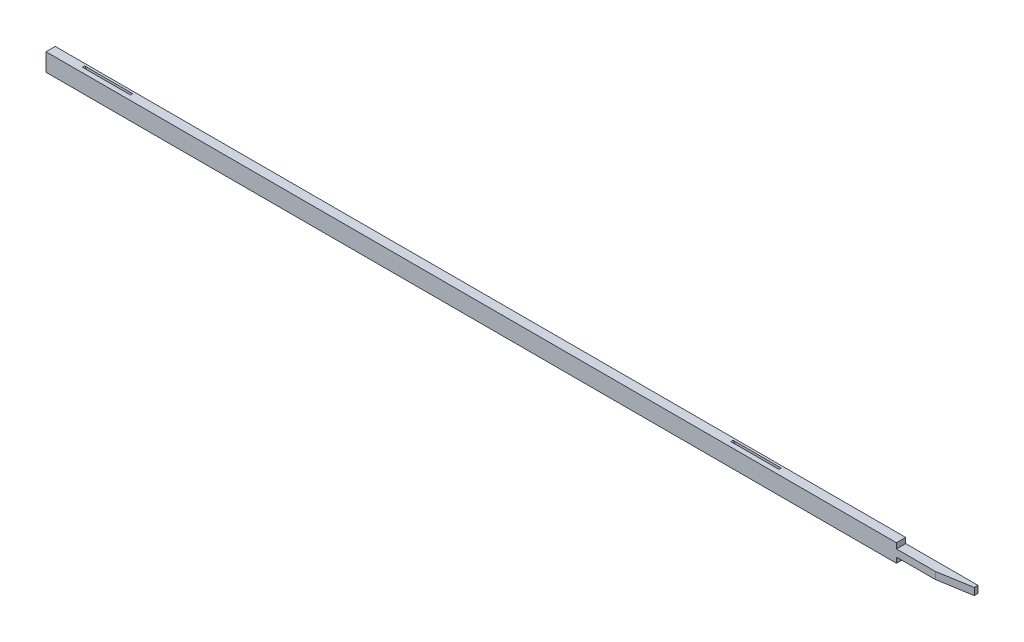
from build123d import *

# Parameters (mm, degrees)
EXTRUDE_1_DEPTH        = 25
SKETCH_2_W             = 115
SKETCH_2_H             = 6
CUT_EXTRUDE_1_DEPTH    = 7.5
MIRROR_START           = 6
MIRROR_1_DEPTH         = 6
PATTERN_LINEAR_1_COUNT = 2
PATTERN_LINEAR_1_PITCH = 1750
CUT_EXTRUDE_2_REACH    = 2492.351


# Read off the part's stored shape, not the designer's step: 镜向1
with BuildPart() as part:
    # 草图1 → 凸台-拉伸1 (new body)
    with BuildSketch(Plane.XY):
        Polygon((0, 24), (0, -24), (2295, -24), (2295, -9.5), (2490, -9.5), (2490, 9.5), (2295, 9.5), (2295, 24), align=None)
    extrude(amount=EXTRUDE_1_DEPTH)

    # 草图2 → 切除-拉伸1 (cut)
    with BuildSketch(Plane.XZ.offset(24)):
        with Locations((1900, 9)):
            Rectangle(SKETCH_2_W, SKETCH_2_H)
    cut_extrude_1 = extrude(amount=-CUT_EXTRUDE_1_DEPTH, mode=Mode.SUBTRACT)

    # 镜向1 outline → 镜向1 (cut)
    with BuildSketch(Plane.XY.offset(MIRROR_START)):
        Polygon((1842.5, 16.5), (1957.5, 16.5), (1965, 24), (1835, 24), align=None)
        Polygon((1835, -24), (1842.5, -24), (1842.5, -16.5), align=None)
        Polygon((1965, -24), (1957.5, -16.5), (1957.5, -24), align=None)
    mirror_1 = extrude(amount=MIRROR_1_DEPTH, mode=Mode.SUBTRACT)

    # 阵列(线性)1: 切除-拉伸1, 镜向1 ×2
    with Locations(*[(-i * PATTERN_LINEAR_1_PITCH, 0, 0) for i in range(1, PATTERN_LINEAR_1_COUNT)]):
        add(cut_extrude_1, mode=Mode.SUBTRACT)
        add(mirror_1, mode=Mode.SUBTRACT)

    # 草图3 → 切除-拉伸2 (cut, up to next)
    with BuildSketch(Plane.XZ.offset(9.5), mode=Mode.PRIVATE) as cut_extrude_2_sk1:
        Polygon((2400, 25), (2490, 10), (2490, 25), align=None)
    cut_extrude_2_tool1 = extrude(cut_extrude_2_sk1.sketch, amount=-CUT_EXTRUDE_2_REACH, mode=Mode.PRIVATE) & part.part
    add(cut_extrude_2_tool1.solids().sort_by_distance((2460, -9.5, 20))[0], mode=Mode.SUBTRACT)


solid = part.part
